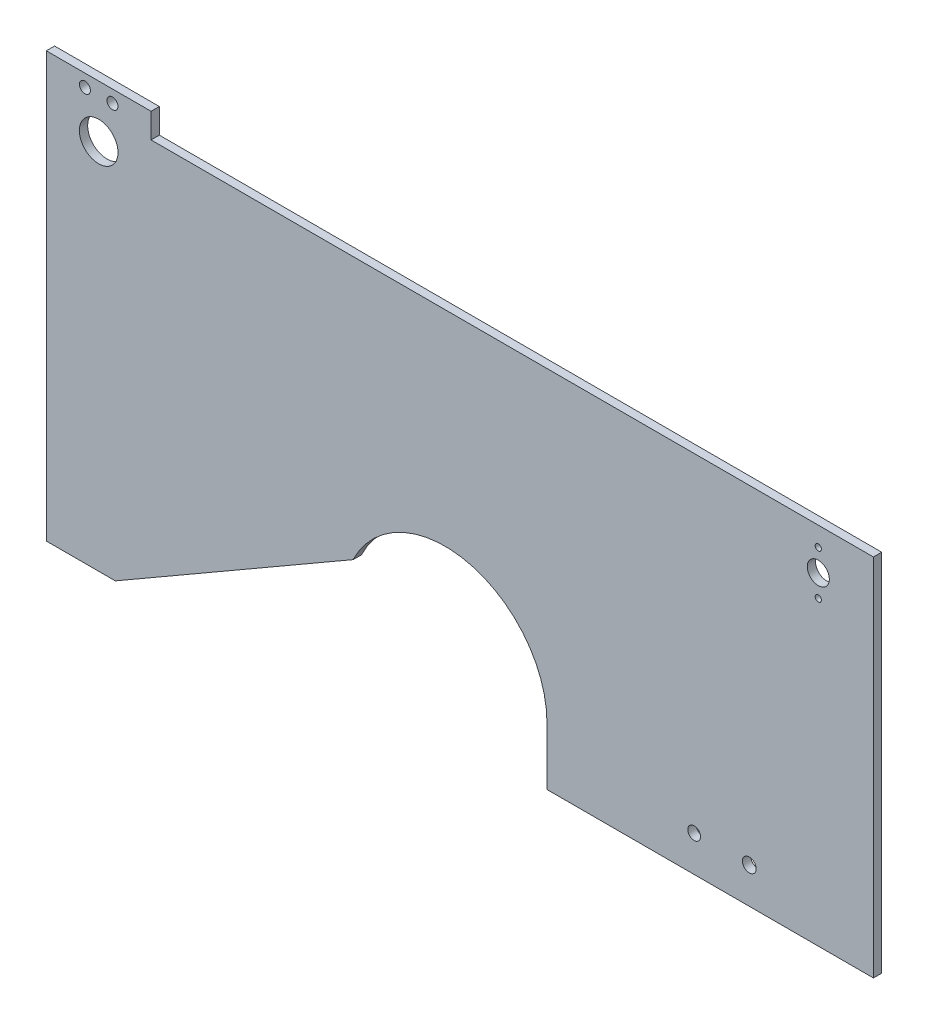
from build123d import *

# Parameters (mm, degrees)
SKETCH2_R           = 7
SKETCH2_R_2         = 2
BOSS_EXTRUDE2_DEPTH = 3
SKETCH3_W           = 118.4
SKETCH3_H           = 12.75
CUT_EXTRUDE1_DEPTH  = 338.231374578
SKETCH5_R           = 2.5
SKETCH5_R_2         = 2.306063735
SKETCH5_R_3         = 4
SKETCH5_R_4         = 1.125
CUT_EXTRUDE2_DEPTH  = 338.231374578


with BuildPart() as part:
    # Sketch2 → Boss-Extrude2 (new body)
    with BuildSketch(Plane.XY):
        with BuildLine():
            Line((25.03035901, 0), (111.286489227, 49.8))
            ThreePointArc((111.286489227, 49.8), (152.858332199, 69.766604349), (181.6, 33.7))
            Line((181.6, 33.7), (181.6, 0))
            Line((181.6, 0), (300, 0))
            Line((300, 0), (300, 145))
            Line((300, 145), (38, 145))
            Line((38, 145), (38, 154))
            Line((38, 154), (19, 154))
            Line((19, 154), (0, 154))
            Line((0, 154), (0, 0))
            Line((0, 0), (25.03035901, 0))
        make_face()
        with Locations((19, 135)):
            Circle(SKETCH2_R, mode=Mode.SUBTRACT)
        with Locations((14, 149.5)):
            Circle(SKETCH2_R_2, mode=Mode.SUBTRACT)
        with Locations((24, 149.5)):
            Circle(SKETCH2_R_2, mode=Mode.SUBTRACT)
    extrude(amount=BOSS_EXTRUDE2_DEPTH)

    # Sketch3 → Cut-Extrude1 (cut, through all)
    with BuildSketch(Plane.XY.offset(3)):
        with Locations((240.8, 6.375)):
            Rectangle(SKETCH3_W, SKETCH3_H)
    extrude(amount=-CUT_EXTRUDE1_DEPTH, mode=Mode.SUBTRACT)

    # Sketch5 → Cut-Extrude2 (cut, through all)
    with BuildSketch(Plane.XY.offset(3)):
        with Locations((254.98, 25.75)):
            Circle(SKETCH5_R)
        with Locations((234.98, 25.75)):
            Circle(SKETCH5_R_2)
        with Locations((280, 130)):
            Circle(SKETCH5_R_3)
        with Locations((280, 138)):
            Circle(SKETCH5_R_4)
        with Locations((280, 122)):
            Circle(SKETCH5_R_4)
    extrude(amount=-CUT_EXTRUDE2_DEPTH, mode=Mode.SUBTRACT)


solid = part.part
